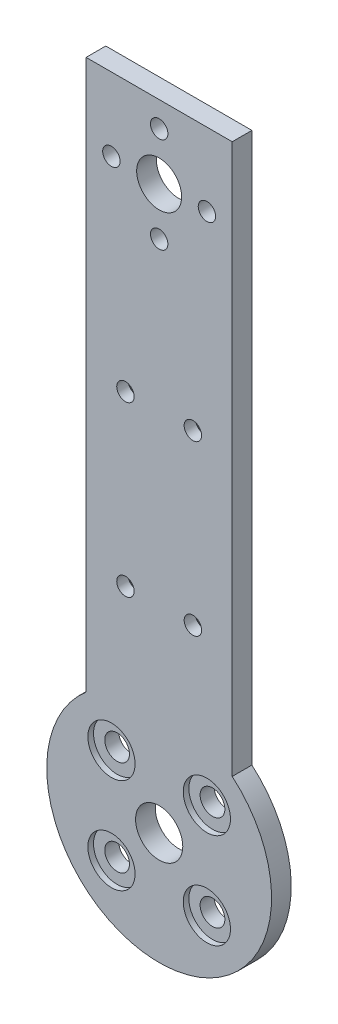
from build123d import *

# Parameters (mm, degrees)
SKETCH1_R           = 2.2
SKETCH1_R_2         = 4.2
SKETCH1_R_3         = 4
SKETCH1_R_4         = 1.55
BOSS_EXTRUDE1_DEPTH = 3.5
SKETCH3_R           = 4.2
CUT_EXTRUDE1_DEPTH  = 1
SKETCH4_R           = 3.5
CUT_EXTRUDE2_DEPTH  = 1.5


with BuildPart() as part:
    # Sketch1 → Boss-Extrude1 (new body)
    with BuildSketch(Plane.XY):
        with BuildLine():
            Line((13, 113), (-13, 113))
            Line((-13, 113), (-13, 15.198684154))
            ThreePointArc((-13, 15.198684154), (0, -20), (13, 15.198684154))
            Line((13, 15.198684154), (13, 113))
        make_face()
        with Locations((8.485281374, 8.485281374)):
            Circle(SKETCH1_R, mode=Mode.SUBTRACT)
        with Locations((8.485281374, -8.485281374)):
            Circle(SKETCH1_R, mode=Mode.SUBTRACT)
        with Locations((-8.485281374, -8.485281374)):
            Circle(SKETCH1_R, mode=Mode.SUBTRACT)
        with Locations((-8.485281374, 8.485281374)):
            Circle(SKETCH1_R, mode=Mode.SUBTRACT)
        Circle(SKETCH1_R_2, mode=Mode.SUBTRACT)
        with Locations((0, 100)):
            Circle(SKETCH1_R_3, mode=Mode.SUBTRACT)
        with Locations((0, 108.5)):
            Circle(SKETCH1_R_4, mode=Mode.SUBTRACT)
        with Locations((8.5, 100)):
            Circle(SKETCH1_R_4, mode=Mode.SUBTRACT)
        with Locations((0, 91.5)):
            Circle(SKETCH1_R_4, mode=Mode.SUBTRACT)
        with Locations((-8.5, 100)):
            Circle(SKETCH1_R_4, mode=Mode.SUBTRACT)
        with Locations((6, 65)):
            Circle(SKETCH1_R_4, mode=Mode.SUBTRACT)
        with Locations((6, 35)):
            Circle(SKETCH1_R_4, mode=Mode.SUBTRACT)
        with Locations((-6, 65)):
            Circle(SKETCH1_R_4, mode=Mode.SUBTRACT)
        with Locations((-6, 35)):
            Circle(SKETCH1_R_4, mode=Mode.SUBTRACT)
    extrude(amount=BOSS_EXTRUDE1_DEPTH)

    # Sketch3 → Cut-Extrude1 (cut)
    with BuildSketch(Plane.XY.offset(3.5)):
        with Locations((-8.485281374, 8.485281374)):
            Circle(SKETCH3_R)
        with Locations((8.485281374, 8.485281374)):
            Circle(SKETCH3_R)
        with Locations((8.485281374, -8.485281374)):
            Circle(SKETCH3_R)
        with Locations((-8.485281374, -8.485281374)):
            Circle(SKETCH3_R)
    extrude(amount=-CUT_EXTRUDE1_DEPTH, mode=Mode.SUBTRACT)

    # Sketch4 → Cut-Extrude2 (cut)
    with BuildSketch(Plane(origin=(0, 0, 0), x_dir=(-1, 0, 0), z_dir=(0, 0, -1))):
        with Locations((-6, 35)):
            Circle(SKETCH4_R)
        with Locations((6, 35)):
            Circle(SKETCH4_R)
        with Locations((-6, 65)):
            Circle(SKETCH4_R)
        with Locations((6, 65)):
            Circle(SKETCH4_R)
    extrude(amount=-CUT_EXTRUDE2_DEPTH, mode=Mode.SUBTRACT)


solid = part.part
